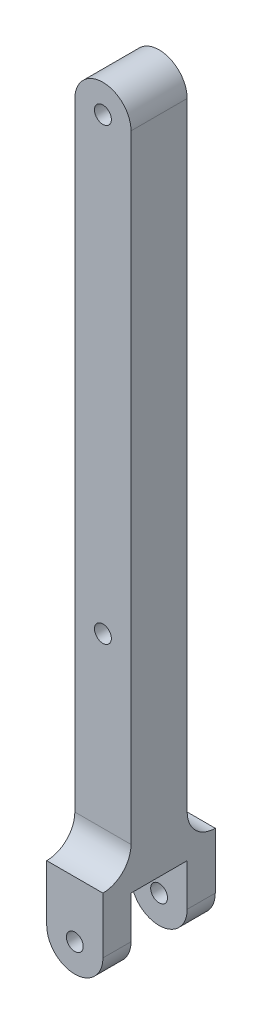
from build123d import *

# Parameters (mm, degrees)
CROQUIS1_R              = 1.5
SALIENTE_EXTRUIR1_DEPTH = 10
SALIENTE_EXTRUIR2_START = -5
CROQUIS3_R              = 1.5
SALIENTE_EXTRUIR2_DEPTH = 5
CROQUIS5_W              = 10
CROQUIS5_H              = 12.5
CORTAR_EXTRUIR1_DEPTH   = 16
CROQUIS2_R              = 1.5
SALIENTE_EXTRUIR3_DEPTH = 5
REDONDEO1_R             = 5


with BuildPart() as part:
    # Croquis1 → Saliente-Extruir1 (new body)
    with BuildSketch(Plane.XY):
        with BuildLine():
            Line((5, 0), (5, -125))
            ThreePointArc((5, -125), (0, -130), (-5, -125))
            Line((-5, -125), (-5, 0))
            ThreePointArc((-5, 0), (0, 5), (5, 0))
        make_face()
        Circle(CROQUIS1_R, mode=Mode.SUBTRACT)
        with Locations((0, -125)):
            Circle(CROQUIS1_R, mode=Mode.SUBTRACT)
        with Locations((0, -80)):
            Circle(CROQUIS1_R, mode=Mode.SUBTRACT)
    extrude(amount=SALIENTE_EXTRUIR1_DEPTH)

    # Croquis3 → Saliente-Extruir2 (add)
    with BuildSketch(Plane.XY.offset(SALIENTE_EXTRUIR2_START)):
        with BuildLine():
            Line((-5, -125), (-5, -115))
            Line((-5, -115), (5, -115))
            Line((5, -115), (5, -125))
            ThreePointArc((5, -125), (0, -130), (-5, -125))
        make_face()
        with Locations((0, -125)):
            Circle(CROQUIS3_R, mode=Mode.SUBTRACT)
    extrude(amount=SALIENTE_EXTRUIR2_DEPTH)

    # Croquis5 → Cortar-Extruir1 (cut)
    with BuildSketch(Plane.ZY.offset(5)):
        with Locations((5, -123.75)):
            Rectangle(CROQUIS5_W, CROQUIS5_H)
    extrude(amount=-CORTAR_EXTRUIR1_DEPTH, mode=Mode.SUBTRACT)

    # Croquis2 → Saliente-Extruir3 (add)
    with BuildSketch(Plane.XY.offset(10)):
        with BuildLine():
            Line((-5, -125), (-5, -115))
            Line((-5, -115), (5, -115))
            Line((5, -115), (5, -125))
            ThreePointArc((5, -125), (0, -130), (-5, -125))
        make_face()
        with Locations(Location((0, -125, 0), (0, 0, 180))):
            Circle(CROQUIS2_R, mode=Mode.SUBTRACT)
    extrude(amount=SALIENTE_EXTRUIR3_DEPTH)

    # Redondeo1
    redondeo1_edges = [part.edges().sort_by_distance(p)[0] for p in [
        (0, -115, 10),
        (0, -115, 0),
    ]]
    fillet(redondeo1_edges, radius=REDONDEO1_R - 0.0001)  # a hair under: the kernel refuses the full size


solid = part.part
